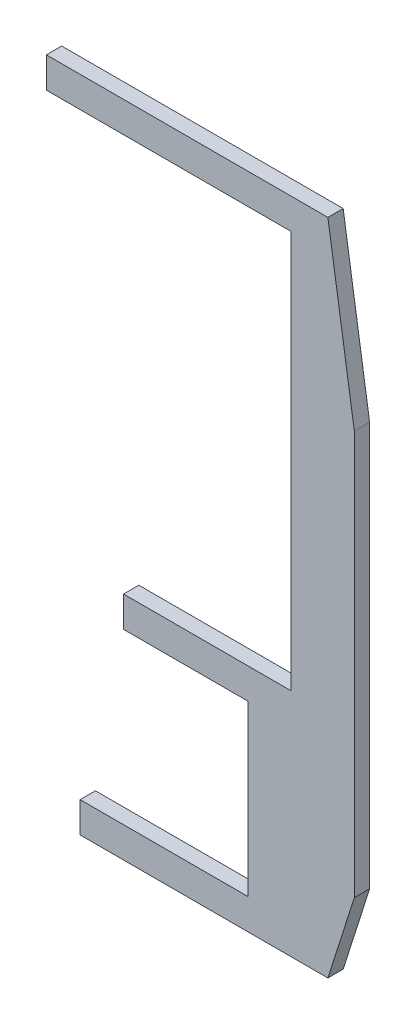
from build123d import *

# Parameters (mm, degrees)
BOSS_EXTRUDE1_DEPTH = 3.175


with BuildPart() as part:
    # Sketch1 → Boss-Extrude1 (new body)
    with BuildSketch(Plane.XY):
        Polygon((0, 0), (50.8, 0), (50.8, -82.55), (16.006948617, -82.55), (16.006948617, -88.9), (41.796049059, -88.9), (41.796049059, -124.004762344), (7.002997676, -124.004762344), (7.002997676, -130.354762344), (58.42, -130.354762344), (63.908299652, -113.18014891), (63.908299652, -29.323947739), (58.42, 6.35), (0, 6.35), align=None)
    extrude(amount=BOSS_EXTRUDE1_DEPTH)


solid = part.part
